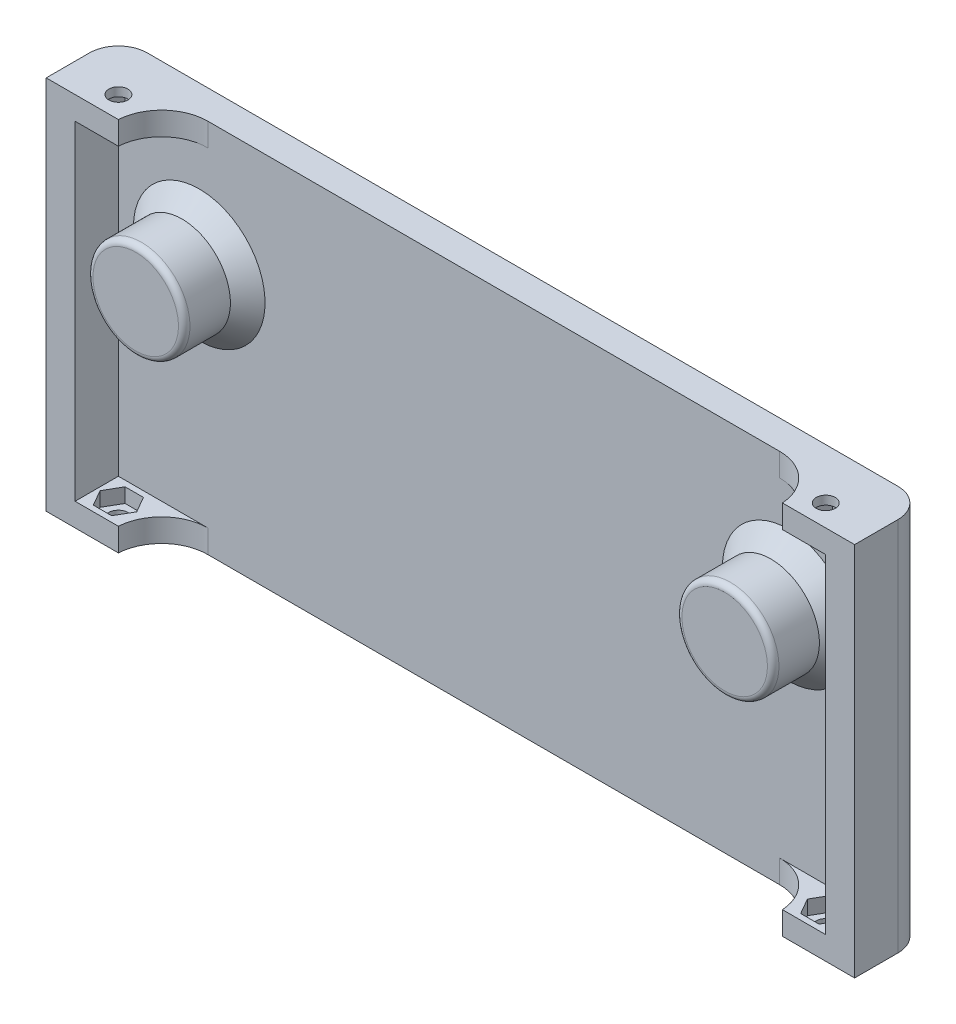
from build123d import *

# Parameters (mm, degrees)
SKETCH1_W            = 140
SKETCH1_H            = 65
BOSS_EXTRUDE1_DEPTH  = 12.5
SKETCH3_W            = 130
SKETCH3_H            = 7.5
CUT_EXTRUDE1_DEPTH   = 155.858806659
FILLET1_R            = 5
SKETCH4_W            = 7.5
SKETCH4_H            = 7.5
BOSS_EXTRUDE2_DEPTH  = 4
SKETCH5_R            = 1.65
CUT_EXTRUDE2_DEPTH   = 2.5
SKETCH5_3_R          = 1.65
CUT_EXTRUDE3_DEPTH   = 154.222876882
FILLET2_R            = 8
FILLET2_OF_MIRROR1_R = 8
SKETCH7_R            = 8.4
BOSS_EXTRUDE3_DEPTH  = 11
FILLET3_R            = 1
CHAMFER1_SIZE        = 3


with BuildPart() as part:
    # Sketch1 → Boss-Extrude1 (new body)
    with BuildSketch(Plane.XY):
        with Locations((70, 32.5)):
            Rectangle(SKETCH1_W, SKETCH1_H)
    extrude(amount=BOSS_EXTRUDE1_DEPTH)

    # Sketch3 → Cut-Extrude1 (cut, through all)
    with BuildSketch(Plane(origin=(0, 65, 0), x_dir=(1, 0, 0), z_dir=(0, 1, 0))):
        with Locations((70, -8.75)):
            Rectangle(SKETCH3_W, SKETCH3_H)
    extrude(amount=-CUT_EXTRUDE1_DEPTH, mode=Mode.SUBTRACT)

    # Fillet1
    fillet1_edges = [part.edges().sort_by_distance(p)[0] for p in [
        (140, 32.5, 0),
        (0, 32.5, 0),
    ]]
    fillet(fillet1_edges, radius=FILLET1_R)

    # Sketch4 → Boss-Extrude2 (add)
    with BuildSketch(Plane.XZ):
        with Locations((8.75, 8.75)):
            Rectangle(SKETCH4_W, SKETCH4_H)
        with Locations((131.25, 8.75)):
            Rectangle(SKETCH4_W, SKETCH4_H)
    boss_extrude2 = extrude(amount=-BOSS_EXTRUDE2_DEPTH)

    # Sketch5 → Cut-Extrude2 (cut)
    # profile 1 of 2: a face of its own
    with BuildSketch(Plane(origin=(0, 4, 0), x_dir=(1, 0, 0), z_dir=(0, 1, 0))):
        Polygon((134.425426481, -8.75), (132.83771324, -6), (129.66228676, -6), (128.074573519, -8.75), (129.66228676, -11.5), (132.83771324, -11.5), align=None)
        with Locations(Location((131.25, -8.75, 0), (0, 0, 270))):
            Circle(SKETCH5_R, mode=Mode.SUBTRACT)
    # profile 2 of 2: a face of its own
    with BuildSketch(Plane(origin=(0, 4, 0), x_dir=(1, 0, 0), z_dir=(0, 1, 0))):
        Polygon((10.33771324, -6), (11.925426481, -8.75), (10.33771324, -11.5), (7.16228676, -11.5), (5.574573519, -8.75), (7.16228676, -6), align=None)
        with Locations(Location((8.75, -8.75, 0), (0, 0, 90))):
            Circle(SKETCH5_R, mode=Mode.SUBTRACT)
    cut_extrude2 = extrude(amount=-CUT_EXTRUDE2_DEPTH, mode=Mode.SUBTRACT)

    # Sketch5<3> → Cut-Extrude3 (cut, through all)
    with BuildSketch(Plane(origin=(0, 4, 0), x_dir=(1, 0, 0), z_dir=(0, 1, 0))):
        with Locations(Location((8.75, -8.75, 0), (0, 0, 270))):
            Circle(SKETCH5_3_R)
        with Locations(Location((131.25, -8.75, 0), (0, 0, 270))):
            Circle(SKETCH5_3_R)
    cut_extrude3 = extrude(amount=-CUT_EXTRUDE3_DEPTH, mode=Mode.SUBTRACT)

    # Fillet2
    # the kernel refuses this fillet: 8 mm, written as the material it adds along each edge
    with BuildSketch(Plane(origin=(127.5, 0, 5), x_dir=(-1, 0, 0), z_dir=(0, 1, 0))) as fillet2_piece_1:
        with BuildLine():
            CenterArc((7.984359711, 8), FILLET2_R, 183.583321698, 86.416678302)
            Line((0, 7.5), (-0.159687194, 7.49))
            ThreePointArc((-0.159687194, 7.49), (-0.16, 3.75), (-0.16, 0))
            Line((-0.16, 0), (0, -0.16))
            Line((0, -0.16), (7.984359711, -0.16))
            Line((7.984359711, -0.16), (7.984359711, 0))
        make_face()
    extrude(amount=4)
    with BuildSketch(Plane(origin=(12.5, 0, 5), x_dir=(1, 0, 0), z_dir=(0, 1, 0))) as fillet2_piece_2:
        with BuildLine():
            CenterArc((7.984359711, -8), FILLET2_R, 90, 86.416678302)
            Line((0, -7.5), (-0.159687194, -7.49))
            ThreePointArc((-0.159687194, -7.49), (-0.16, -3.75), (-0.16, 0))
            Line((-0.16, 0), (0, 0.16))
            Line((0, 0.16), (7.984359711, 0.16))
            Line((7.984359711, 0.16), (7.984359711, 0))
        make_face()
    extrude(amount=4)

    # Mirror1: Boss-Extrude2, Cut-Extrude2, Cut-Extrude3 across plane
    add(boss_extrude2.mirror(Plane.ZX.offset(32.5)))
    add(cut_extrude2.mirror(Plane.ZX.offset(32.5)), mode=Mode.SUBTRACT)
    add(cut_extrude3.mirror(Plane.ZX.offset(32.5)), mode=Mode.SUBTRACT)

    # Fillet2 of Mirror1
    # the kernel refuses this fillet: 8 mm, written as the material it adds along each edge
    with BuildSketch(Plane(origin=(127.5, 65, 5), x_dir=(0, 0, 1), z_dir=(0, -1, 0))) as fillet2_of_mirror1_piece_1:
        with BuildLine():
            CenterArc((8, 7.984359711), FILLET2_OF_MIRROR1_R, 180, 86.416678302)
            Line((0, 7.984359711), (-0.16, 7.984359711))
            Line((-0.16, 7.984359711), (-0.16, 0))
            Line((-0.16, 0), (0, -0.16))
            ThreePointArc((0, -0.16), (3.75, -0.16), (7.49, -0.159687194))
            Line((7.49, -0.159687194), (7.5, 0))
        make_face()
    extrude(amount=4)
    with BuildSketch(Plane(origin=(12.5, 65, 5), x_dir=(0, 0, 1), z_dir=(0, -1, 0))) as fillet2_of_mirror1_piece_2:
        with BuildLine():
            CenterArc((8, -7.984359711), FILLET2_OF_MIRROR1_R, 93.583321698, 86.416678302)
            Line((0, -7.984359711), (-0.16, -7.984359711))
            Line((-0.16, -7.984359711), (-0.16, 0))
            Line((-0.16, 0), (0, 0.16))
            ThreePointArc((0, 0.16), (3.75, 0.16), (7.49, 0.159687194))
            Line((7.49, 0.159687194), (7.5, 0))
        make_face()
    extrude(amount=4)

    # Sketch7 → Boss-Extrude3 (add)
    with BuildSketch(Plane.XY.offset(5)):
        with Locations(Location((121, 42.7, 0), (0, 0, 180))):
            Circle(SKETCH7_R)
        with Locations(Location((19, 42.7, 0), (0, 0, 180))):
            Circle(SKETCH7_R)
    extrude(amount=BOSS_EXTRUDE3_DEPTH)

    # Fillet3
    fillet3_edges = [part.edges().sort_by_distance(p)[0] for p in [
        (129.4, 42.7, 16),
        (27.4, 42.7, 16),
    ]]
    fillet(fillet3_edges, radius=FILLET3_R)

    # Chamfer1
    chamfer1_edges = [part.edges().sort_by_distance(p)[0] for p in [
        (129.4, 42.7, 5),
        (27.4, 42.7, 5),
    ]]
    chamfer(chamfer1_edges, length=CHAMFER1_SIZE)


solid = part.part
